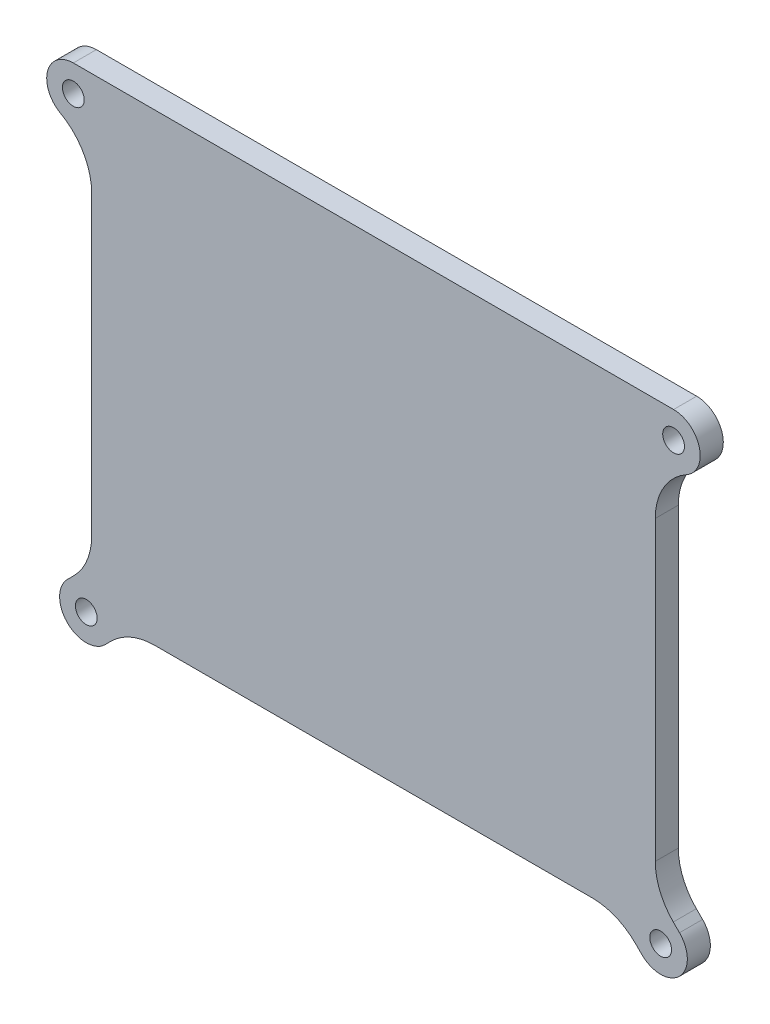
from build123d import *

# Parameters (mm, degrees)
BOSS_EXTRUDE1_DEPTH  = 4.7625
M4_CLEARANCE_HOLE1_D = 4.5


with BuildPart() as part:
    # Sketch2 → Boss-Extrude1 (new body)
    with BuildSketch(Plane.XY):
        with BuildLine():
            Line((-58.18125, 26.496758268), (-58.18125, -34.823813165))
            ThreePointArc((-58.18125, -34.823813165), (-59.147979937, -39.683892756), (-61.900993879, -43.804069286))
            Line((-61.900993879, -43.804069286), (-63.182817689, -45.085893096))
            ThreePointArc((-63.182817689, -45.085893096), (-63.182817689, -52.864067689), (-55.404643096, -52.864067689))
            Line((-55.404643096, -52.864067689), (-54.122819286, -51.582243879))
            ThreePointArc((-54.122819286, -51.582243879), (-50.002642756, -48.829229937), (-45.142563165, -47.8625))
            Line((-45.142563165, -47.8625), (45.142563165, -47.8625))
            ThreePointArc((45.142563165, -47.8625), (50.002642756, -48.829229937), (54.122819286, -51.582243879))
            Line((54.122819286, -51.582243879), (55.404643096, -52.864067689))
            ThreePointArc((55.404643096, -52.864067689), (63.182817689, -52.864067689), (63.182817689, -45.085893096))
            Line((63.182817689, -45.085893096), (61.900993879, -43.804069286))
            ThreePointArc((61.900993879, -43.804069286), (59.147979937, -39.683892756), (58.18125, -34.823813165))
            Line((58.18125, -34.823813165), (58.18125, 26.496758268))
            ThreePointArc((58.18125, 26.496758268), (59.919591901, 32.910185724), (64.658738462, 37.567907718))
            ThreePointArc((64.658738462, 37.567907718), (67.284676339, 43.7552926), (61.96395, 47.8625))
            Line((61.96395, 47.8625), (-61.96395, 47.8625))
            ThreePointArc((-61.96395, 47.8625), (-67.284676339, 43.7552926), (-64.658738462, 37.567907718))
            ThreePointArc((-64.658738462, 37.567907718), (-59.919591901, 32.910185724), (-58.18125, 26.496758268))
        make_face()
    extrude(amount=BOSS_EXTRUDE1_DEPTH)

    # M4 Clearance Hole1 (through all)
    with Locations(Plane.XY.offset(4.7625)):
        with Locations((-61.96395, 42.3625), (-59.293730392, -48.974980392), (59.293730392, -48.974980392), (61.96395, 42.3625)):
            Hole(M4_CLEARANCE_HOLE1_D / 2)


solid = part.part
